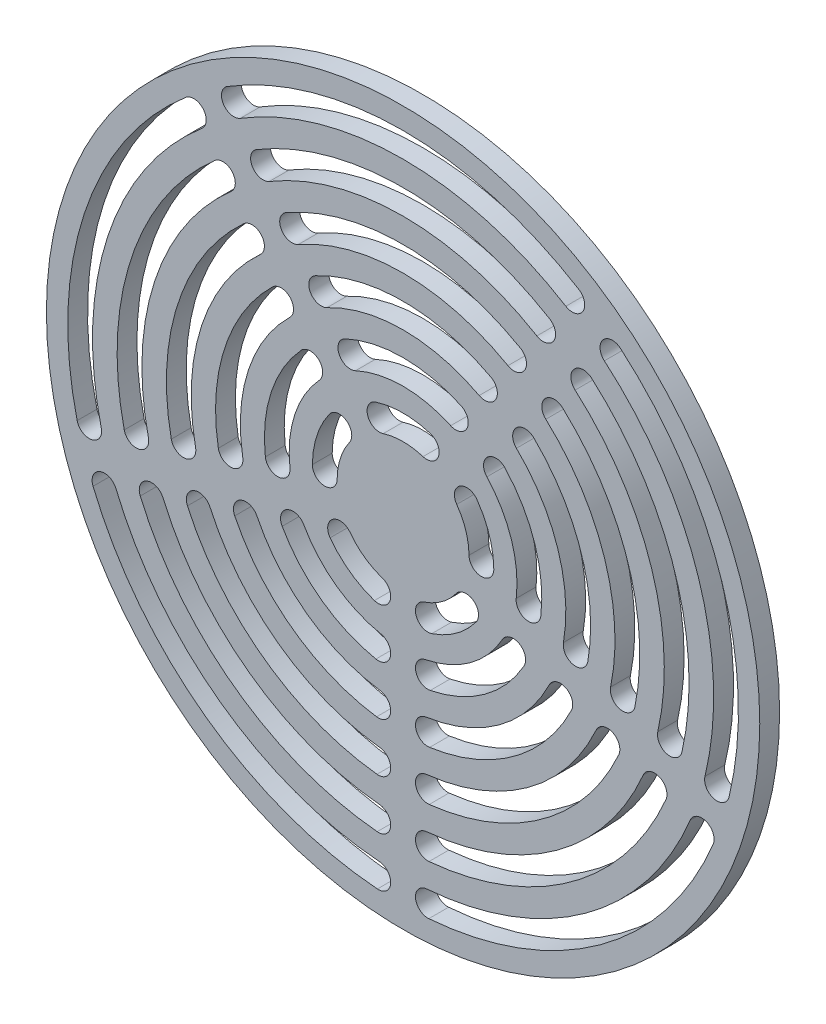
from build123d import *

# Parameters (mm, degrees)
EXTRUDE_2_DEPTH          = 2
CUT_EXTRUDE_5_DEPTH      = 42.806183605
PATTERN_START            = -2
PATTERN_LINEAR_6_DEPTH   = 2
PATTERN_CIRCULAR_2_COUNT = 5


# Read off the part's stored shape, not the designer's step: Линейный массив6
with BuildPart() as part:
    # Эскиз6 → Бобышка-Вытянуть2 (new body)
    with BuildSketch(Plane.XY):
        with BuildLine():
            Line((0, 0), (-21.160269083, 29.124611797))
            ThreePointArc((-21.160269083, 29.124611797), (0, 36), (21.160269083, 29.124611797))
            Line((21.160269083, 29.124611797), (0, 0))
        make_face()
    extrude_2 = extrude(amount=-EXTRUDE_2_DEPTH)

    # Эскиз8 → Вырез-Вытянуть5 (cut, through all)
    with BuildSketch(Plane.XY):
        with BuildLine():
            ThreePointArc((2.763082425, 8.728809248), (0, 9.15569415), (-2.763082425, 8.728809248))
            ThreePointArc((-2.763082425, 8.728809248), (-3.577565566, 7.15985507), (-2.008611388, 6.345371929))
            ThreePointArc((-2.008611388, 6.345371929), (0, 6.65569415), (2.008611388, 6.345371929))
            ThreePointArc((2.008611388, 6.345371929), (3.577565566, 7.15985507), (2.763082425, 8.728809248))
        make_face()
    cut_extrude_5 = extrude(amount=-CUT_EXTRUDE_5_DEPTH, mode=Mode.SUBTRACT)

    # Линейный массив6 outline → Линейный массив6 (cut)
    with BuildSketch(Plane.XY.offset(PATTERN_START)):
        with BuildLine():
            ThreePointArc((-10.584064165, 18.586121936), (0, 21.388462845), (10.584064165, 18.586121936))
            ThreePointArc((10.584064165, 18.586121936), (12.288849258, 19.053783979), (11.821187216, 20.758569072))
            ThreePointArc((11.821187216, 20.758569072), (0, 23.888462845), (-11.821187216, 20.758569072))
            ThreePointArc((-11.821187216, 20.758569072), (-12.288849258, 19.053783979), (-10.584064165, 18.586121936))
        make_face()
        with BuildLine():
            ThreePointArc((-7.679367639, 14.522246343), (0, 16.42766953), (7.679367639, 14.522246343))
            ThreePointArc((7.679367639, 14.522246343), (9.368713619, 15.042928742), (8.84803122, 16.732274722))
            ThreePointArc((8.84803122, 16.732274722), (0, 18.92766953), (-8.84803122, 16.732274722))
            ThreePointArc((-8.84803122, 16.732274722), (-9.368713619, 15.042928742), (-7.679367639, 14.522246343))
        make_face()
        with BuildLine():
            ThreePointArc((-16.425471774, 26.69787158), (0, 31.346012026), (16.425471774, 26.69787158))
            ThreePointArc((16.425471774, 26.69787158), (18.145122081, 27.107509008), (17.735484653, 28.827159315))
            ThreePointArc((17.735484653, 28.827159315), (0, 33.846012026), (-17.735484653, 28.827159315))
            ThreePointArc((-17.735484653, 28.827159315), (-18.145122081, 27.107509008), (-16.425471774, 26.69787158))
        make_face()
        with BuildLine():
            ThreePointArc((-13.501393974, 22.643792845), (0, 26.363402543), (13.501393974, 22.643792845))
            ThreePointArc((13.501393974, 22.643792845), (15.215189583, 23.077272498), (14.78170993, 24.791068107))
            ThreePointArc((14.78170993, 24.791068107), (0, 28.863402543), (-14.78170993, 24.791068107))
            ThreePointArc((-14.78170993, 24.791068107), (-15.215189583, 23.077272498), (-13.501393974, 22.643792845))
        make_face()
        with BuildLine():
            ThreePointArc((-4.802636201, 10.446449807), (0, 11.497548784), (4.802636201, 10.446449807))
            ThreePointArc((4.802636201, 10.446449807), (6.460498921, 11.060038594), (5.846910135, 12.717901314))
            ThreePointArc((5.846910135, 12.717901314), (0, 13.997548784), (-5.846910135, 12.717901314))
            ThreePointArc((-5.846910135, 12.717901314), (-6.460498921, 11.060038594), (-4.802636201, 10.446449807))
        make_face()
    pattern_linear_6 = extrude(amount=PATTERN_LINEAR_6_DEPTH, mode=Mode.SUBTRACT)

    # Круговой массив2: Бобышка-Вытянуть2, Вырез-Вытянуть5, Линейный массив6 ×5 about axis
    pattern_circular_2_axis = Axis((0, 0, 0), (0, 0, 1))
    add([extrude_2.rotate(pattern_circular_2_axis, i * 360 / PATTERN_CIRCULAR_2_COUNT) for i in range(1, PATTERN_CIRCULAR_2_COUNT)])
    add([cut_extrude_5.rotate(pattern_circular_2_axis, i * 360 / PATTERN_CIRCULAR_2_COUNT) for i in range(1, PATTERN_CIRCULAR_2_COUNT)], mode=Mode.SUBTRACT)
    add([pattern_linear_6.rotate(pattern_circular_2_axis, i * 360 / PATTERN_CIRCULAR_2_COUNT) for i in range(1, PATTERN_CIRCULAR_2_COUNT)], mode=Mode.SUBTRACT)


solid = part.part
